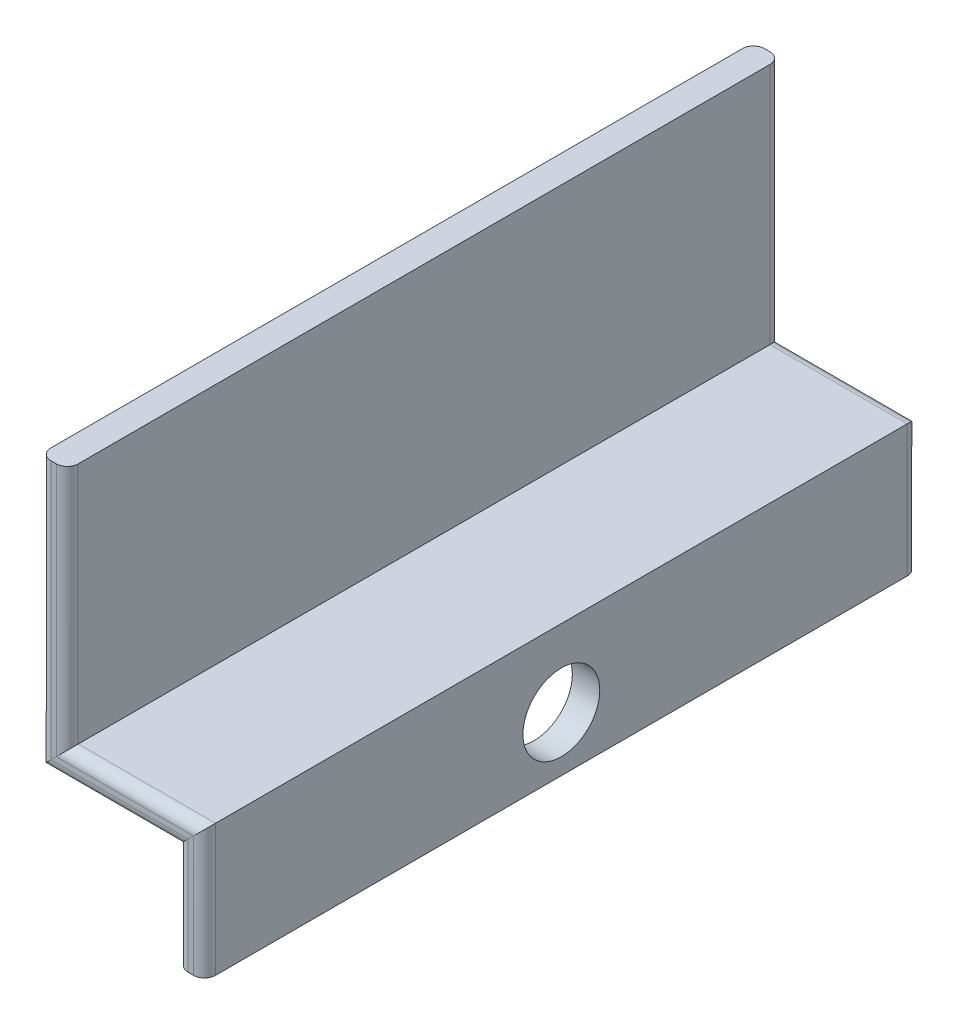
from build123d import *

# Parameters (mm, degrees)
CUT_EXTRUDE1_DEPTH      = 99.145249503
CUT_EXTRUDE1_DEPTH_BACK = 99.145249503
SKETCH3_R               = 7


with BuildPart() as part:
    # Sweep1: sweep along a curve in space
    with BuildLine() as sweep1_path:
        Line((0, 0, 0), (0, 21.5, 0))
        Line((0, 21.5, 0), (-25, 21.5, 0))
        Line((-25, 21.5, 0), (-25, 68.2, 0))
    # Sketch2 → Sweep1 (sweep)
    with BuildSketch(Plane(origin=(0, 0, 0), x_dir=(1, 0, 0), z_dir=(0, 1, 0))):
        with BuildLine():
            Line((-0.5, 65), (0.5, 65))
            ThreePointArc((0.5, 65), (1.914213562, 64.414213562), (2.5, 63))
            Line((2.5, 63), (2.5, -63))
            ThreePointArc((2.5, -63), (1.914213562, -64.414213562), (0.5, -65))
            Line((0.5, -65), (-0.5, -65))
            ThreePointArc((-0.5, -65), (-1.914213562, -64.414213562), (-2.5, -63))
            Line((-2.5, -63), (-2.5, 63))
            ThreePointArc((-2.5, 63), (-1.914213562, 64.414213562), (-0.5, 65))
        make_face()
    sweep(path=sweep1_path.line, transition=Transition.RIGHT)

    # Sketch3 → Cut-Extrude1 (cut, two sides: drawn at the far end of the back side and taken through both)
    with BuildSketch(Plane(origin=(0, 0, 0), x_dir=(0, 0, -1), z_dir=(1, 0, 0)).offset(-CUT_EXTRUDE1_DEPTH_BACK)):
        with Locations((0, 10)):
            Circle(SKETCH3_R)
    extrude(amount=CUT_EXTRUDE1_DEPTH + CUT_EXTRUDE1_DEPTH_BACK, mode=Mode.SUBTRACT)


solid = part.part
